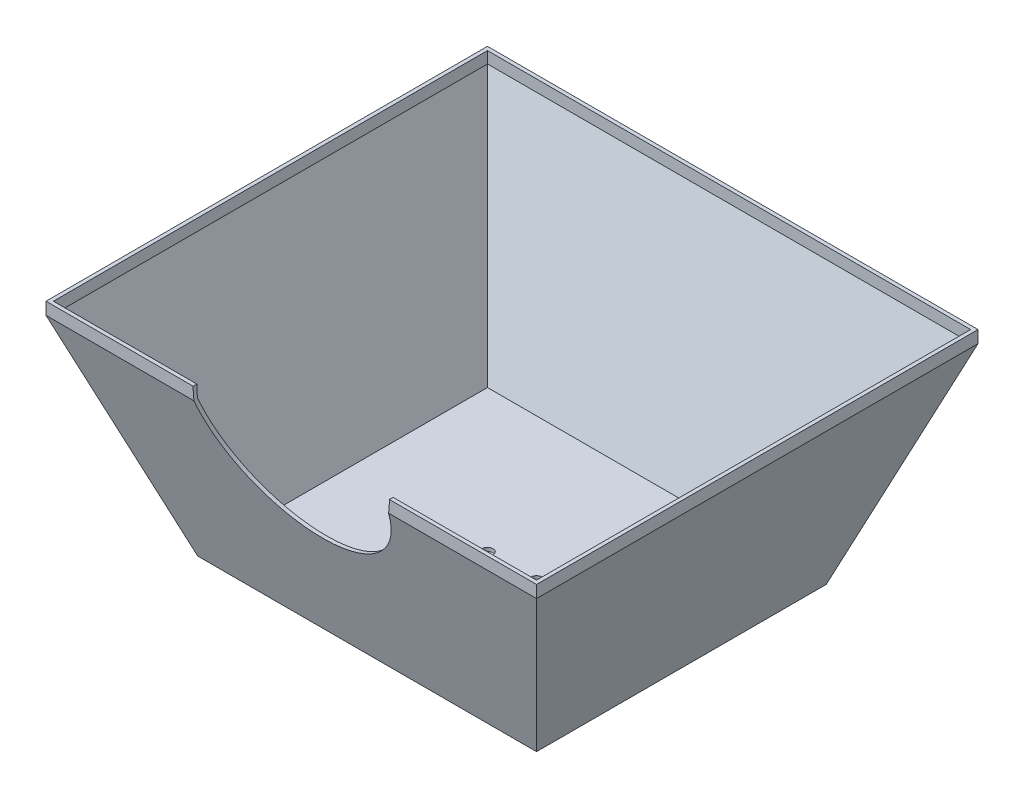
from build123d import *

# Parameters (mm, degrees)
SKETCH1_W               = 200
SKETCH1_H               = 180
BOSS_EXTRUDE1_DEPTH     = 90
CUT_EXTRUDE1_DEPTH      = 284.725219182
CUT_EXTRUDE1_DEPTH_BACK = 284.725219182
CUT_EXTRUDE2_DEPTH      = 284.725219182
SHELL1_T                = -1.5
SKETCH6_R               = 2.25
HINGE_HOLES_DEPTH       = 284.252978802
CUT_EXTRUDE4_DEPTH      = 50


with BuildPart() as part:
    # Sketch1 → Boss-Extrude1 (new body)
    with BuildSketch(Plane(origin=(0, 0, 0), x_dir=(1, 0, 0), z_dir=(0, 1, 0))):
        with Locations((100, 90)):
            Rectangle(SKETCH1_W, SKETCH1_H)
    extrude(amount=BOSS_EXTRUDE1_DEPTH)

    # Sketch4 → Cut-Extrude1 (cut, two sides: drawn at the far end of the back side and taken through both)
    with BuildSketch(Plane.XY.offset(-CUT_EXTRUDE1_DEPTH_BACK)):
        Polygon((0, 85), (30.937469913, 0), (0, 0), align=None)
        Polygon((200, 85), (200, 0), (169.062530087, 0), align=None)
    extrude(amount=CUT_EXTRUDE1_DEPTH + CUT_EXTRUDE1_DEPTH_BACK, mode=Mode.SUBTRACT)

    # Sketch5 → Cut-Extrude2 (cut, through all)
    with BuildSketch(Plane.ZY):
        Polygon((-180, 85), (-149.062530087, 0), (-180, 0), align=None)
        Polygon((0, 85), (-30.937469913, 0), (0, 0), align=None)
    extrude(amount=-CUT_EXTRUDE2_DEPTH, mode=Mode.SUBTRACT)

    # Shell1
    shell1_openings = [part.faces().sort_by_distance(p)[0] for p in [
        (100, 90, -90),
    ]]
    offset(amount=SHELL1_T, openings=shell1_openings, kind=Kind.INTERSECTION)

    # Sketch6 → Hinge-Holes (cut, through all)
    with BuildSketch(Plane(origin=(0, 1.5, 0), x_dir=(1, 0, 0), z_dir=(0, 1, 0))):
        with Locations((90, 90)):
            Circle(SKETCH6_R)
        with Locations((110, 90)):
            Circle(SKETCH6_R)
    extrude(amount=-HINGE_HOLES_DEPTH, mode=Mode.SUBTRACT)

    # Sketch7 → Cut-Extrude4 (cut)
    with BuildSketch(Plane.XY):
        with BuildLine():
            Line((140, 90), (60, 90))
            ThreePointArc((60, 90), (100, 50), (140, 90))
        make_face()
    extrude(amount=-CUT_EXTRUDE4_DEPTH, mode=Mode.SUBTRACT)


solid = part.part
